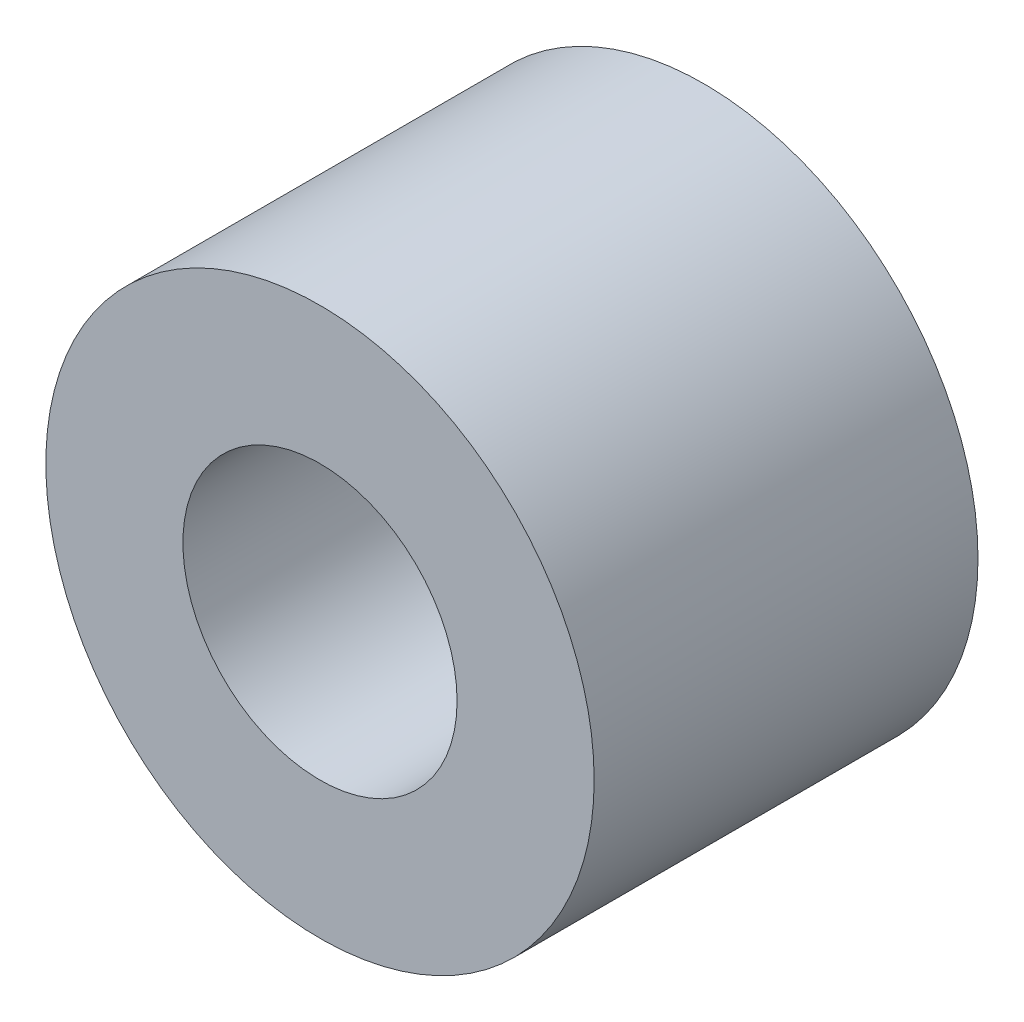
from build123d import *

# Parameters (mm, degrees)
CROQUIS1_R              = 5
CROQUIS1_R_2            = 2.5
SALIENTE_EXTRUIR1_DEPTH = 7


with BuildPart() as part:
    # Croquis1 → Saliente-Extruir1 (new body)
    with BuildSketch(Plane.XY):
        with Locations((54.9, 15.2)):
            Circle(CROQUIS1_R)
        with Locations((54.9, 15.2)):
            Circle(CROQUIS1_R_2, mode=Mode.SUBTRACT)
    extrude(amount=SALIENTE_EXTRUIR1_DEPTH)


solid = part.part
